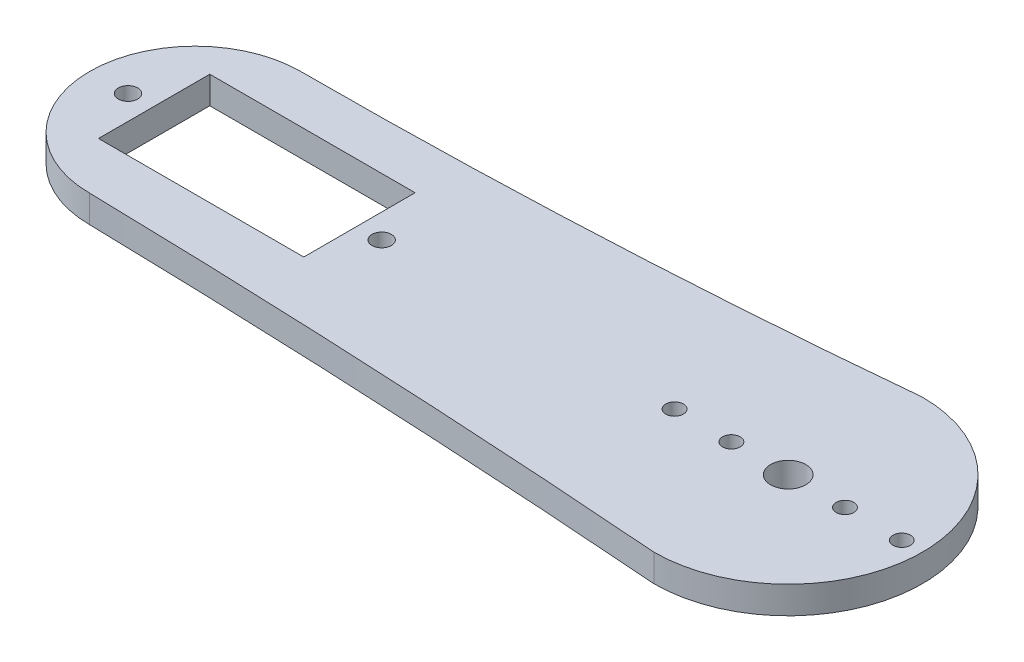
from build123d import *

# Parameters (mm, degrees)
SKETCH1_R           = 0.96512
SKETCH1_R_2         = 1.061627907
SKETCH1_W           = 22.5
SKETCH1_H           = 12.2
SKETCH1_R_3         = 0.965116279
SKETCH1_R_4         = 1.93023
BOSS_EXTRUDE1_DEPTH = 3


with BuildPart() as part:
    # Sketch1 → Boss-Extrude1 (new body)
    with BuildSketch(Plane(origin=(0, 0, 0), x_dir=(1, 0, 0), z_dir=(0, 1, 0))):
        with BuildLine():
            ThreePointArc((8.930411, 29.537706621), (-23.531257698, 27.169784495), (-56.069589, 26.379856745))
            ThreePointArc((-56.069589, 26.379856745), (-67.626425529, 14.823020216), (-56.069589, 3.266183687))
            ThreePointArc((-56.069589, 3.266183687), (-23.547873557, 2.134241063), (8.930411, 0.108333416))
            ThreePointArc((8.930411, 0.108333416), (23.645097602, 14.823020019), (8.930411, 29.537706621))
        make_face()
        with Locations((15.15541, 14.82302)):
            Circle(SKETCH1_R, mode=Mode.SUBTRACT)
        with Locations((-63.424099948, 14.823020216)):
            Circle(SKETCH1_R_2, mode=Mode.SUBTRACT)
        with Locations((-49.524099948, 15.035810914)):
            Rectangle(SKETCH1_W, SKETCH1_H, mode=Mode.SUBTRACT)
        with Locations((-35.624099948, 14.823020216)):
            Circle(SKETCH1_R_2, mode=Mode.SUBTRACT)
        with Locations((-3.519589, 14.823020019)):
            Circle(SKETCH1_R_3, mode=Mode.SUBTRACT)
        with Locations((2.705411, 14.823020019)):
            Circle(SKETCH1_R_3, mode=Mode.SUBTRACT)
        with Locations((8.930411, 14.823020019)):
            Circle(SKETCH1_R_4, mode=Mode.SUBTRACT)
        with Locations((21.380409, 14.823020019)):
            Circle(SKETCH1_R, mode=Mode.SUBTRACT)
    extrude(amount=BOSS_EXTRUDE1_DEPTH)


solid = part.part
